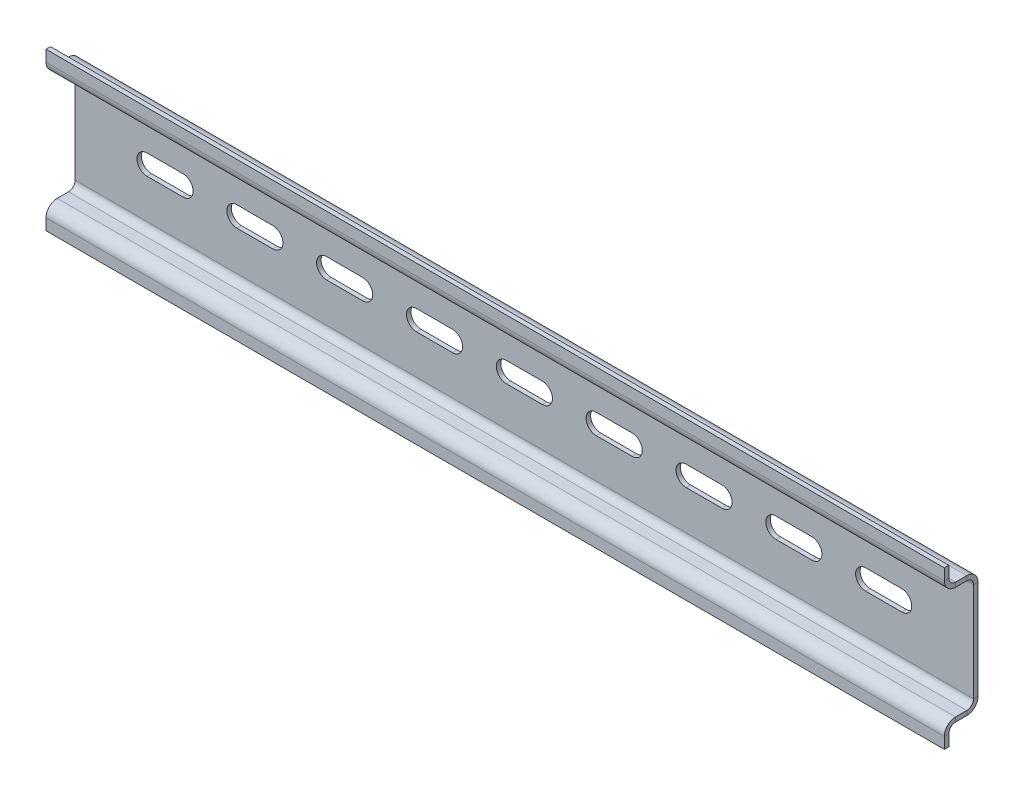
from build123d import *

# Parameters (mm, degrees)
SKETCH_1_W                         = 200
SKETCH_1_H                         = 27
SM_BASE_FLANGE_1_DEPTH             = 1
SM_EDGE_FLANGE_1_STRIP_W           = 7
SM_EDGE_FLANGE_1_STRIP_H           = 1
SM_EDGE_FLANGE_1_STRIP_CUT_DEPTH   = 200
SM_EDGE_FLANGE_1_STRIP_2_W         = 7
SM_EDGE_FLANGE_1_STRIP_2_H         = 1
SM_EDGE_FLANGE_1_STRIP_CUT_2_DEPTH = 200
SM_EDGE_FLANGE_1_DEPTH             = 200
SM_EDGE_FLANGE_1_BEND_DEPTH        = 200
SM_EDGE_FLANGE_2_STRIP_W           = 7
SM_EDGE_FLANGE_2_STRIP_H           = 1
SM_EDGE_FLANGE_2_STRIP_CUT_DEPTH   = 200
SM_EDGE_FLANGE_2_STRIP_2_W         = 7
SM_EDGE_FLANGE_2_STRIP_2_H         = 1
SM_EDGE_FLANGE_2_STRIP_CUT_2_DEPTH = 200
SM_EDGE_FLANGE_2_DEPTH             = 200
SM_EDGE_FLANGE_2_BEND_DEPTH        = 200
CUT_EXTRUDE_1_DEPTH                = 10
PATTERN_LINEAR_1_COUNT             = 5
PATTERN_LINEAR_1_PITCH             = 20
PATTERN_LINEAR_1_COL_COUNT         = 5
PATTERN_LINEAR_1_COL_PITCH         = 20


# Sheet-metal steps are written as plain solids
with BuildPart() as part:
    # Sketch 1 → 基体-法兰1 (new body)
    with BuildSketch(Plane.XY):
        Rectangle(SKETCH_1_W, SKETCH_1_H)
    extrude(amount=-SM_BASE_FLANGE_1_DEPTH)

    # 边线-法兰1 strip (across the edge) → 边线-法兰1 strip cut (cut)
    with BuildSketch(Plane(origin=(100, 13.5, 0), x_dir=(0, -1, 0), z_dir=(-1, 0, 0))):
        with Locations((-1, -0.5)):
            Rectangle(SM_EDGE_FLANGE_1_STRIP_W, SM_EDGE_FLANGE_1_STRIP_H)
    extrude(amount=SM_EDGE_FLANGE_1_STRIP_CUT_DEPTH, mode=Mode.SUBTRACT)

    # 边线-法兰1 strip 2 (across the edge) → 边线-法兰1 strip cut 2 (cut)
    with BuildSketch(Plane(origin=(-100, -13.5, 0), x_dir=(0, 1, 0), z_dir=(1, 0, 0))):
        with Locations((-1, -0.5)):
            Rectangle(SM_EDGE_FLANGE_1_STRIP_2_W, SM_EDGE_FLANGE_1_STRIP_2_H)
    extrude(amount=SM_EDGE_FLANGE_1_STRIP_CUT_2_DEPTH, mode=Mode.SUBTRACT)

    # 边线-法兰1 section (across the edge) → 边线-法兰1 (add)
    with BuildSketch(Plane(origin=(100, 13.5, 0), x_dir=(0, -1, 0), z_dir=(-1, 0, 0))):
        with BuildLine():
            Line((0, 1.5), (0, 6.5))
            Line((0, 6.5), (1, 6.5))
            Line((1, 6.5), (1, 1.5))
            ThreePointArc((1, 1.5), (1.439339828, 0.439339828), (2.5, 0))
            Line((2.5, 0), (2.5, -1))
            ThreePointArc((2.5, -1), (0.732233047, -0.267766953), (0, 1.5))
        make_face()
    extrude(amount=SM_EDGE_FLANGE_1_DEPTH)

    # 边线-法兰1 section 2 (across the edge) → 边线-法兰1 bend (add)
    with BuildSketch(Plane(origin=(-100, -13.5, 0), x_dir=(0, 1, 0), z_dir=(1, 0, 0))):
        with BuildLine():
            Line((0, 1.5), (0, 6.5))
            Line((0, 6.5), (1, 6.5))
            Line((1, 6.5), (1, 1.5))
            ThreePointArc((1, 1.5), (1.439339828, 0.439339828), (2.5, 0))
            Line((2.5, 0), (2.5, -1))
            ThreePointArc((2.5, -1), (0.732233047, -0.267766953), (0, 1.5))
        make_face()
    extrude(amount=SM_EDGE_FLANGE_1_BEND_DEPTH)

    # 边线-法兰2 strip (across the edge) → 边线-法兰2 strip cut (cut)
    with BuildSketch(Plane(origin=(-100, 13.5, 6.5), x_dir=(0, 0, -1), z_dir=(1, 0, 0))):
        with Locations((-1, -0.5)):
            Rectangle(SM_EDGE_FLANGE_2_STRIP_W, SM_EDGE_FLANGE_2_STRIP_H)
    extrude(amount=SM_EDGE_FLANGE_2_STRIP_CUT_DEPTH, mode=Mode.SUBTRACT)

    # 边线-法兰2 strip 2 (across the edge) → 边线-法兰2 strip cut 2 (cut)
    with BuildSketch(Plane(origin=(100, -13.5, 6.5), x_dir=(0, 0, -1), z_dir=(-1, 0, 0))):
        with Locations((-1, -0.5)):
            Rectangle(SM_EDGE_FLANGE_2_STRIP_2_W, SM_EDGE_FLANGE_2_STRIP_2_H)
    extrude(amount=SM_EDGE_FLANGE_2_STRIP_CUT_2_DEPTH, mode=Mode.SUBTRACT)

    # 边线-法兰2 section (across the edge) → 边线-法兰2 (add)
    with BuildSketch(Plane(origin=(-100, 13.5, 6.5), x_dir=(0, 0, -1), z_dir=(1, 0, 0))):
        with BuildLine():
            Line((0, 1.5), (0, 4))
            Line((0, 4), (1, 4))
            Line((1, 4), (1, 1.5))
            ThreePointArc((1, 1.5), (1.439339828, 0.439339828), (2.5, 0))
            Line((2.5, 0), (2.5, -1))
            ThreePointArc((2.5, -1), (0.732233047, -0.267766953), (0, 1.5))
        make_face()
    extrude(amount=SM_EDGE_FLANGE_2_DEPTH)

    # 边线-法兰2 section 2 (across the edge) → 边线-法兰2 bend (add)
    with BuildSketch(Plane(origin=(100, -13.5, 6.5), x_dir=(0, 0, -1), z_dir=(-1, 0, 0))):
        with BuildLine():
            Line((0, 1.5), (0, 4))
            Line((0, 4), (1, 4))
            Line((1, 4), (1, 1.5))
            ThreePointArc((1, 1.5), (1.439339828, 0.439339828), (2.5, 0))
            Line((2.5, 0), (2.5, -1))
            ThreePointArc((2.5, -1), (0.732233047, -0.267766953), (0, 1.5))
        make_face()
    extrude(amount=SM_EDGE_FLANGE_2_BEND_DEPTH)

    # 草图18 → 切除-拉伸1 (cut)
    with BuildSketch(Plane(origin=(0, 0, -1), x_dir=(-1, 0, 0), z_dir=(0, 0, -1))):
        with BuildLine():
            Line((-4, 2.25), (4, 2.25))
            ThreePointArc((4, 2.25), (6.25, 0), (4, -2.25))
            Line((4, -2.25), (-4, -2.25))
            ThreePointArc((-4, -2.25), (-6.25, 0), (-4, 2.25))
        make_face()
    cut_extrude_1 = extrude(amount=-CUT_EXTRUDE_1_DEPTH, mode=Mode.SUBTRACT)

    # 阵列(线性)1: 切除-拉伸1 ×5
    with Locations(*[(i * PATTERN_LINEAR_1_PITCH, 0, 0) for i in range(1, PATTERN_LINEAR_1_COUNT)]):
        add(cut_extrude_1, mode=Mode.SUBTRACT)

    # 阵列(线性)1 col: 切除-拉伸1 ×5
    with Locations(*[(-i * PATTERN_LINEAR_1_COL_PITCH, 0, 0) for i in range(1, PATTERN_LINEAR_1_COL_COUNT)]):
        add(cut_extrude_1, mode=Mode.SUBTRACT)


solid = part.part
